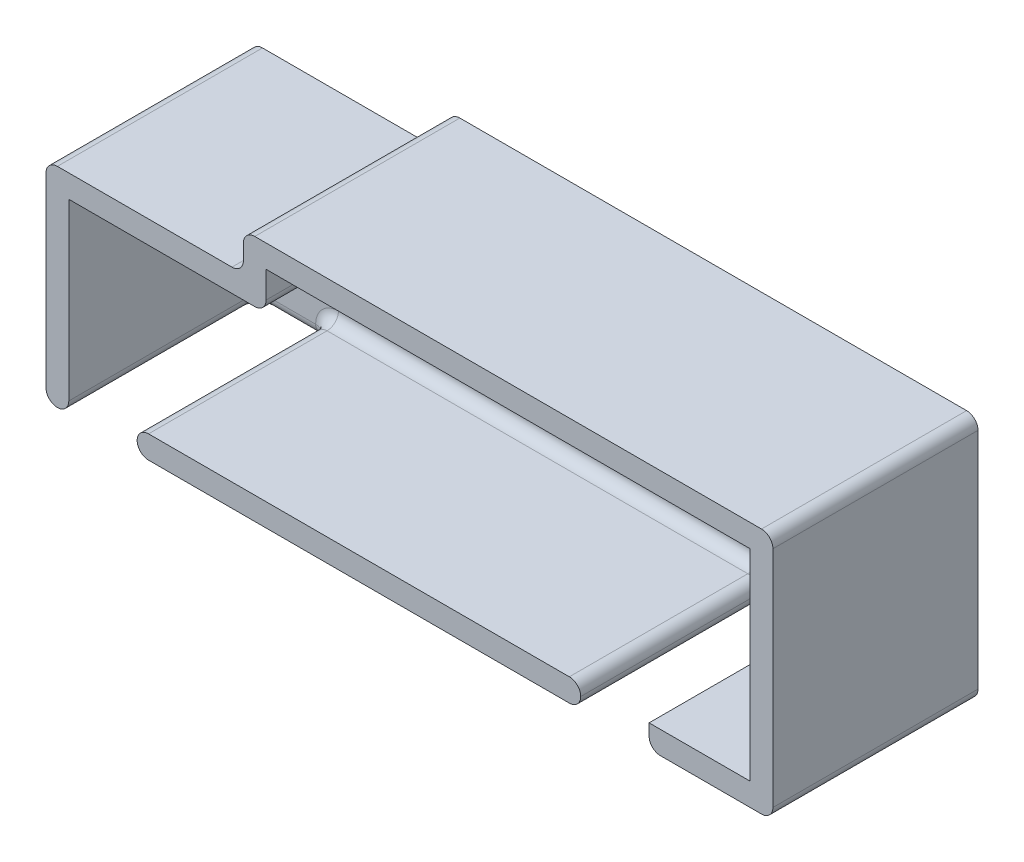
from build123d import *

# Parameters (mm, degrees)
BOSS_EXTRUDE1_DEPTH     = 4
BOSS_EXTRUDE2_DEPTH     = 50
CUT_EXTRUDE1_DEPTH      = 677.427541211
CUT_EXTRUDE1_DEPTH_BACK = 50
SKETCH3_W               = 18
SKETCH3_H               = 6
FILLET3_R               = 3


with BuildPart() as part:
    # Sketch1 → Boss-Extrude1 (new body)
    with BuildSketch(Plane.XY.offset(-724.191392871)):
        Polygon((476.461364297, 467.098298929), (476.461364297, 412.098298929), (285.063110998, 412.098298929), (285.063110998, 467.098298929), (337.030633325, 467.098298929), (337.030633325, 477.098298929), (476.461364297, 477.098298929), align=None)
    extrude(amount=BOSS_EXTRUDE1_DEPTH)

    # Sketch2 → Boss-Extrude2 (add)
    with BuildSketch(Plane.XY.offset(-720.191392871)):
        Polygon((285.063110998, 467.098298929), (285.063110998, 412.098298929), (476.461364297, 412.098298929), (476.461364297, 477.098298929), (337.030633325, 477.098298929), (337.030633325, 467.098298929), align=None)
        Polygon((291.063110998, 461.098298929), (343.030633325, 461.098298929), (343.030633325, 471.098298929), (470.461364297, 471.098298929), (470.461364297, 418.098298929), (291.063110998, 418.098298929), align=None, mode=Mode.SUBTRACT)
    extrude(amount=BOSS_EXTRUDE2_DEPTH)

    # Sketch3 → Cut-Extrude1 (cut, two sides: drawn at the far end of the back side and taken through both)
    with BuildSketch(Plane.XY.offset(-670.191392871).offset(-CUT_EXTRUDE1_DEPTH_BACK)):
        with Locations((300.063110998, 415.098298929)):
            Rectangle(SKETCH3_W, SKETCH3_H)
        with Locations((434.858034082, 415.098298929)):
            Rectangle(SKETCH3_W, SKETCH3_H)
    extrude(amount=CUT_EXTRUDE1_DEPTH + CUT_EXTRUDE1_DEPTH_BACK, mode=Mode.SUBTRACT)

    # Fillet3
    fillet3_edges = [part.edges().sort_by_distance(p)[0] for p in [
        (337.030633325, 477.098298929, -697.191392871),
        (476.461364297, 477.098298929, -697.191392871),
        (476.461364297, 412.098298929, -697.191392871),
        (285.063110998, 412.098298929, -697.191392871),
        (285.063110998, 467.098298929, -697.191392871),
        (337.030633325, 467.098298929, -697.191392871),
        (343.030633325, 461.098298929, -695.191392871),
        (406.745998811, 471.098298929, -720.191392871),
        (343.030633325, 466.098298929, -720.191392871),
        (317.046872162, 461.098298929, -720.191392871),
        (291.063110998, 436.598298929, -720.191392871),
        (470.461364297, 444.598298929, -720.191392871),
        (367.46057254, 418.098298929, -720.191392871),
        (457.159699189, 418.098298929, -720.191392871),
        (309.063110998, 418.098298929, -695.191392871),
        (309.063110998, 415.098298929, -720.191392871),
        (309.063110998, 412.098298929, -695.191392871),
        (291.063110998, 412.098298929, -695.191392871),
        (300.063110998, 412.098298929, -720.191392871),
        (425.858034082, 412.098298929, -695.191392871),
        (425.858034082, 415.098298929, -720.191392871),
        (425.858034082, 418.098298929, -695.191392871),
        (443.858034082, 412.098298929, -695.191392871),
        (443.858034082, 415.098298929, -720.191392871),
        (434.858034082, 412.098298929, -720.191392871),
    ]]
    fillet(fillet3_edges, radius=FILLET3_R - 0.0001)  # a hair under: the kernel refuses the full size


solid = part.part
